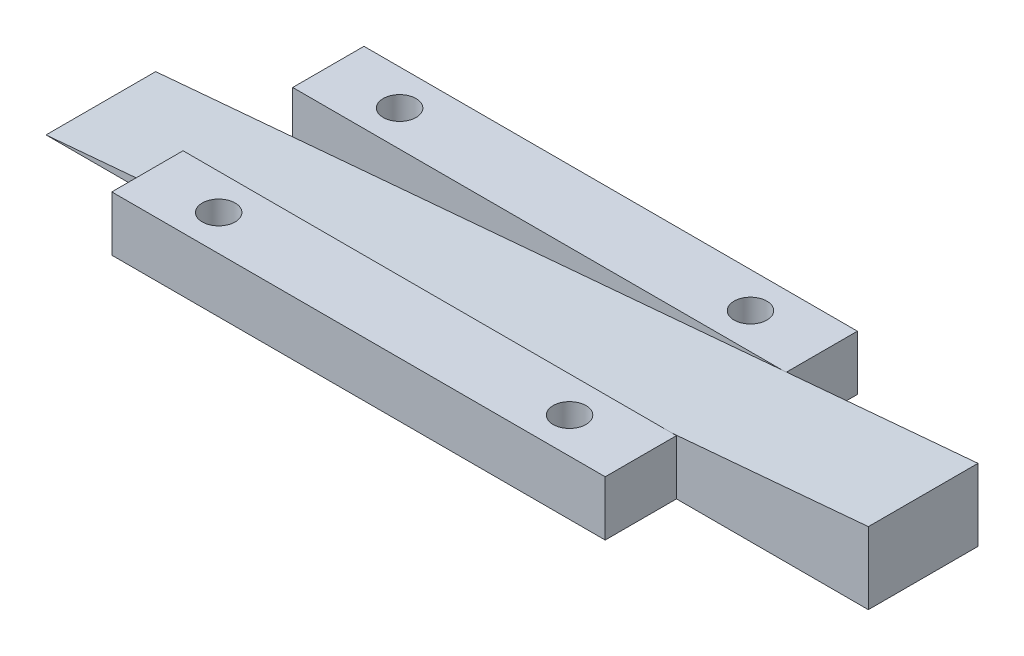
from build123d import *

# Parameters (mm, degrees)
BOSS_EXTRUDE1_DEPTH = 10
SKETCH2_W           = 90
SKETCH2_H           = 10
BOSS_EXTRUDE2_DEPTH = 13
SKETCH3_W           = 90
SKETCH3_H           = 10
BOSS_EXTRUDE3_DEPTH = 13
SKETCH5_R           = 3
CUT_EXTRUDE2_DEPTH  = 13


with BuildPart() as part:
    # Sketch1 → Boss-Extrude1 (new, symmetric)
    with BuildSketch(Plane.XY):
        Polygon((-104.456448669, 0), (45.543551331, 0), (45.543551331, 13.123299529), align=None)
    extrude(amount=BOSS_EXTRUDE1_DEPTH, both=True)

    # Sketch2 → Boss-Extrude2 (add)
    with BuildSketch(Plane.XY.offset(10)):
        with Locations((-34.456448669, 5)):
            Rectangle(SKETCH2_W, SKETCH2_H)
    extrude(amount=BOSS_EXTRUDE2_DEPTH)

    # Sketch3 → Boss-Extrude3 (add)
    with BuildSketch(Plane.XY.offset(-10)):
        with Locations((-34.456448669, 5)):
            Rectangle(SKETCH3_W, SKETCH3_H)
    extrude(amount=-BOSS_EXTRUDE3_DEPTH)

    # Sketch5 → Cut-Extrude2 (cut)
    with BuildSketch(Plane(origin=(0, 10, -10), x_dir=(1, 0, 0), z_dir=(0, -1, 0))):
        with Locations((-66.456448669, 26.5)):
            Circle(SKETCH5_R)
        with Locations((-2.456448669, 26.5)):
            Circle(SKETCH5_R)
        with Locations((-2.456448669, -6.5)):
            Circle(SKETCH5_R)
        with Locations((-66.456448669, -6.5)):
            Circle(SKETCH5_R)
    extrude(amount=CUT_EXTRUDE2_DEPTH, mode=Mode.SUBTRACT)


solid = part.part
